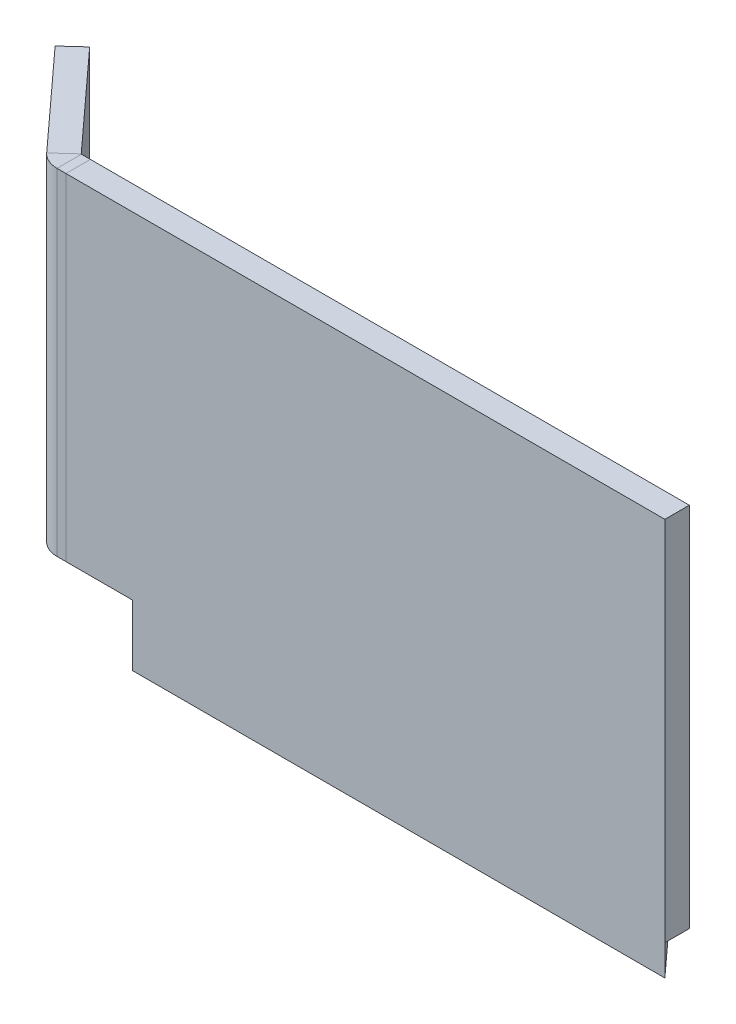
from build123d import *

# Parameters (mm, degrees)
EXTRUDE_1_DEPTH                  = 98
CUT_EXTRUDE_1_DEPTH              = 121.415945788
CUT_EXTRUDE_START                = 5
SKETCH_3_W                       = 12.842534068
SKETCH_3_H                       = 17.787416892
CUT_EXTRUDE_2_DEPTH              = 126.415945788
SKETCH_4_W                       = 4
SKETCH_4_H                       = 65
SM_BASE_FLANGE_1_DEPTH           = 1.5
SM_EDGE_FLANGE_1_STRIP_CUT_DEPTH = 65
SM_EDGE_FLANGE_1_DEPTH           = 65
SKETCH_9_W                       = 52.119762768
SKETCH_9_H                       = 22.239484817
CUT_EXTRUDE_2_2_DEPTH            = 10


# Sheet-metal steps are written as plain solids
with BuildPart() as part:
    # Sketch 1 → Вытянуть1 (new body)
    with BuildSketch(Plane(origin=(0, 0, 0), x_dir=(0, 0, -1), z_dir=(1, 0, 0))):
        Polygon((0, 0), (0, 60), (-4, 60), (-4, -5), (36, -5), (36, 0), align=None)
    extrude(amount=-EXTRUDE_1_DEPTH)

    # Эскиз2 → Вырез-Вытянуть1 (cut, through all)
    with BuildSketch(Plane(origin=(0, 0, 0), x_dir=(1, 0, 0), z_dir=(0, 1, 0))):
        Polygon((0, -4), (0, 52.377582957), (-36.515857127, 36), align=None)
    extrude(amount=-CUT_EXTRUDE_1_DEPTH, mode=Mode.SUBTRACT)

    # Эскиз3 → Cut-Extrude 2 (cut, through all)
    with BuildSketch(Plane(origin=(0, 0, 0), x_dir=(1, 0, 0), z_dir=(0, 1, 0)).offset(CUT_EXTRUDE_START)):
        with Locations((-93.575487089, 6.916408518)):
            Rectangle(SKETCH_3_W, SKETCH_3_H)
    extrude(amount=-CUT_EXTRUDE_2_DEPTH, mode=Mode.SUBTRACT)


with BuildPart() as body_2:
    # Эскиз4 → Базовая кромка1 (new body)
    with BuildSketch(Plane.ZY.offset(98)):
        with Locations((2, 27.5)):
            Rectangle(SKETCH_4_W, SKETCH_4_H)
    extrude(amount=SM_BASE_FLANGE_1_DEPTH)

    # Ребро-кромка1 strip (across the edge) → Ребро-кромка1 strip cut (cut)
    with BuildSketch(Plane(origin=(-99.5, -5, 0), x_dir=(0.7385395687806503, 0, -0.6742101344130709), z_dir=(0, 1, 0))):
        Polygon((-14.628602565, 7.938304662), (-2.664261551, -2.983899516), (0.032578987, -0.02974124), (-11.931762028, 10.892462937), align=None)
    extrude(amount=SM_EDGE_FLANGE_1_STRIP_CUT_DEPTH, mode=Mode.SUBTRACT)

    # Ребро-кромка1 section (across the edge) → Ребро-кромка1 (add)
    with BuildSketch(Plane(origin=(-99.5, -5, 0), x_dir=(0.7385395687806503, 0, -0.6742101344130709), z_dir=(0, 1, 0))):
        with BuildLine():
            Line((-4, 0.044112716), (-4, 21.5))
            Line((-4, 21.5), (0, 21.5))
            Line((0, 21.5), (0, 0.044112716))
            ThreePointArc((0, 0.044112716), (0.008506554, 0.003752472), (0.032578987, -0.02974124))
            Line((0.032578987, -0.02974124), (-2.664261551, -2.983899516))
            ThreePointArc((-2.664261551, -2.983899516), (-3.651231288, -1.610657304), (-4, 0.044112716))
        make_face()
    extrude(amount=SM_EDGE_FLANGE_1_DEPTH)


with BuildPart() as cut_extrude_2_2_tool:
    # Эскиз9 → Cut-Extrude 2 2 (new body)
    with BuildSketch(Plane.XZ.offset(5)):
        with Locations((-113.12645526, -5.307596352)):
            Rectangle(SKETCH_9_W, SKETCH_9_H)
    extrude(amount=-CUT_EXTRUDE_2_2_DEPTH)


with BuildPart() as part_1:
    add(part.part)

    # Cut-Extrude 2 2: cut by cut_extrude_2_2_tool
    add(cut_extrude_2_2_tool.part, mode=Mode.SUBTRACT)


with BuildPart() as body_2_1:
    add(body_2.part)

    # Cut-Extrude 2 2: cut by cut_extrude_2_2_tool
    add(cut_extrude_2_2_tool.part, mode=Mode.SUBTRACT)


solid = Compound([part_1.part, body_2_1.part])
